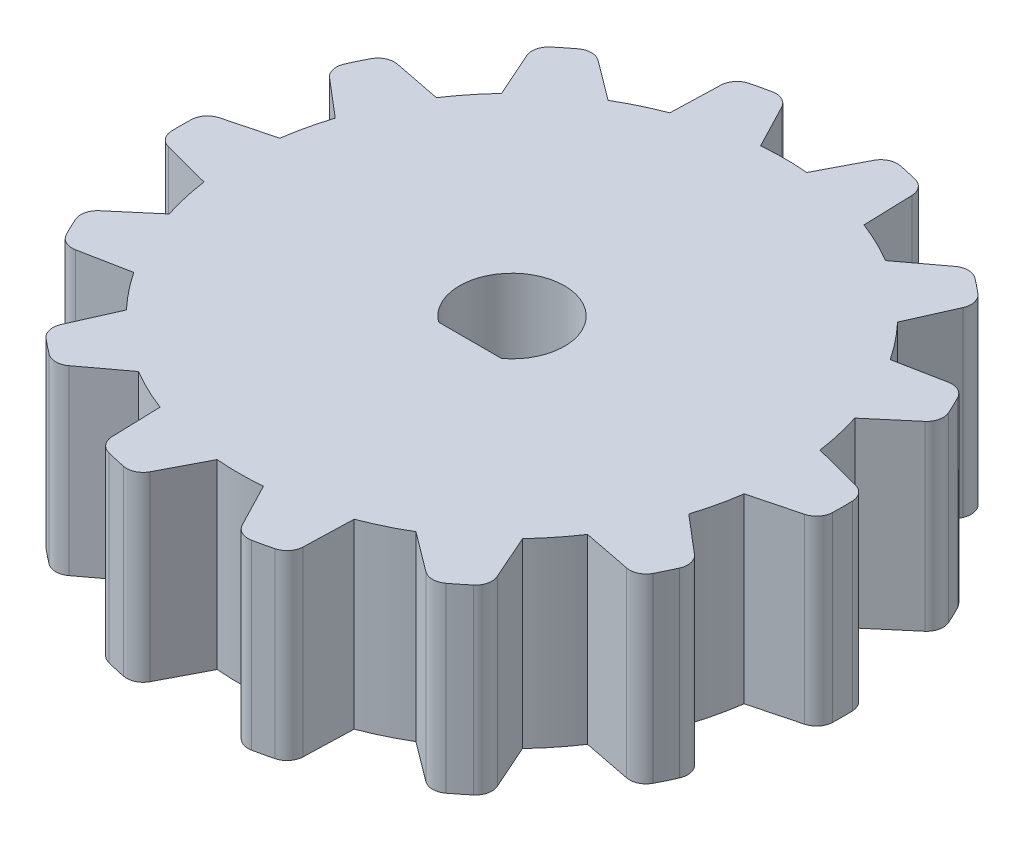
from build123d import *

# Parameters (mm, degrees)
SKETCH1_R                = 20
BOSS_EXTRUDE1_DEPTH      = 11
CUT_EXTRUDE1_REACH       = 32.348
FILLET1_R                = 1
CIRPATTERN1_COUNT        = 14
FILLET1_OF_CIRPATTERN1_R = 1
CUT_EXTRUDE2_REACH       = 32.113


with BuildPart() as part:
    # Sketch1 → Boss-Extrude1 (new body)
    with BuildSketch(Plane(origin=(0, 0, 0), x_dir=(1, 0, 0), z_dir=(0, 1, 0))):
        Circle(SKETCH1_R)
    extrude(amount=BOSS_EXTRUDE1_DEPTH)

    # Sketch2 → Cut-Extrude1 (cut, up to next)
    with BuildSketch(Plane(origin=(0, 11, 0), x_dir=(1, 0, 0), z_dir=(0, 1, 0)), mode=Mode.PRIVATE) as cut_extrude1_sk1:
        with BuildLine():
            Line((-3.125, 19.754350787), (-1.399921321, 16.440505476))
            ThreePointArc((-1.399921321, 16.440505476), (0, 16.5), (1.399921321, 16.440505476))
            Line((1.399921321, 16.440505476), (3.125, 19.754350787))
            ThreePointArc((3.125, 19.754350787), (0, 20), (-3.125, 19.754350787))
        make_face()
    cut_extrude1_tool1 = extrude(cut_extrude1_sk1.sketch, amount=-CUT_EXTRUDE1_REACH, mode=Mode.PRIVATE) & part.part
    cut_extrude1 = cut_extrude1_tool1.solids().sort_by_distance((0, 11, -18.420369))[0]
    add(cut_extrude1, mode=Mode.SUBTRACT)

    # Fillet1
    fillet1_edges = [part.edges().sort_by_distance(p)[0] for p in [
        (3.125, 5.5, -19.754350787),
        (-3.125, 5.5, -19.754350787),
    ]]
    fillet(fillet1_edges, radius=FILLET1_R)

    # CirPattern1: Cut-Extrude1 ×14 about axis
    cirpattern1_axis = Axis((0, 11, 0), (0, -1, 0))
    for i in range(1, CIRPATTERN1_COUNT):
        add(cut_extrude1.rotate(cirpattern1_axis, i * 360 / CIRPATTERN1_COUNT), mode=Mode.SUBTRACT)

    # Fillet1 of CirPattern1
    fillet1_of_cirpattern1_edges = [part.edges().sort_by_distance(p)[0] for p in [
        (11.386619295, 5.5, -16.44216838),
        (5.755563871, 5.5, -19.153941749),
        (17.392978991, 5.5, -9.873412875),
        (13.49616773, 5.5, -14.75985964),
        (19.954445887, 5.5, -1.349106861),
        (18.56369005, 5.5, -7.442406312),
        (18.56369005, 5.5, 7.442406312),
        (19.954445887, 5.5, 1.349106861),
        (13.49616773, 5.5, 14.75985964),
        (17.392978991, 5.5, 9.873412875),
        (5.755563871, 5.5, 19.153941749),
        (11.386619295, 5.5, 16.44216838),
        (-3.125, 5.5, 19.754350787),
        (3.125, 5.5, 19.754350787),
        (-11.386619295, 5.5, 16.44216838),
        (-5.755563871, 5.5, 19.153941749),
        (-17.392978991, 5.5, 9.873412875),
        (-13.49616773, 5.5, 14.75985964),
        (-19.954445887, 5.5, 1.349106861),
        (-18.56369005, 5.5, 7.442406312),
        (-18.56369005, 5.5, -7.442406312),
        (-19.954445887, 5.5, -1.349106861),
        (-13.49616773, 5.5, -14.75985964),
        (-17.392978991, 5.5, -9.873412875),
        (-5.755563871, 5.5, -19.153941749),
        (-11.386619295, 5.5, -16.44216838),
    ]]
    fillet(fillet1_of_cirpattern1_edges, radius=FILLET1_OF_CIRPATTERN1_R)

    # Sketch3 → Cut-Extrude2 (cut, up to next)
    with BuildSketch(Plane(origin=(0, 11, 0), x_dir=(1, 0, 0), z_dir=(0, 1, 0)), mode=Mode.PRIVATE) as cut_extrude2_sk1:
        with BuildLine():
            Line((1.905, -2.54), (-1.905, -2.54))
            ThreePointArc((-1.905, -2.54), (0, 3.175), (1.905, -2.54))
        make_face()
    cut_extrude2_tool1 = extrude(cut_extrude2_sk1.sketch, amount=-CUT_EXTRUDE2_REACH, mode=Mode.PRIVATE) & part.part
    add(cut_extrude2_tool1.solids().sort_by_distance((0, 11, -0.153521))[0], mode=Mode.SUBTRACT)


solid = part.part
